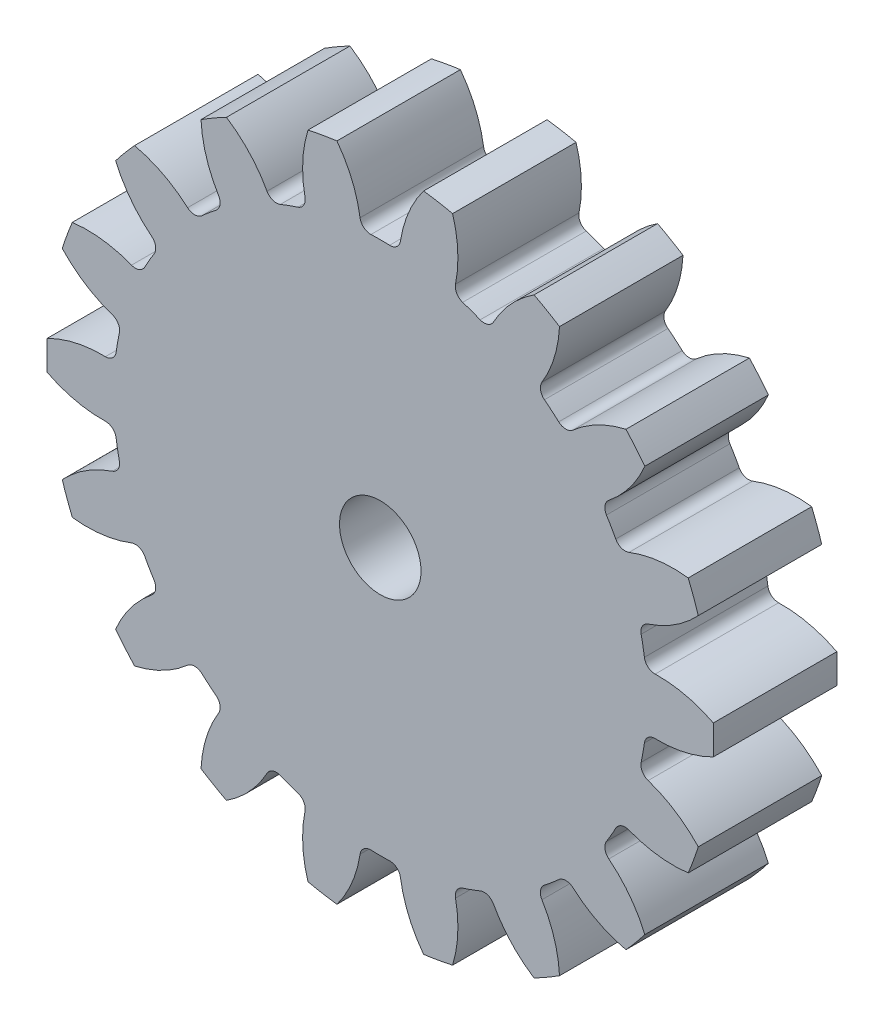
from build123d import *

# Parameters (mm, degrees)
SKETCH1_R                      = 13.5
BOSS_EXTRUDE1_DEPTH            = 2.5
CUT_EXTRUDE1_DEPTH             = 20.254869514
FILLET2_R                      = 0.43
CIRPATTERN1_COUNT              = 18
FILLET2_OF_CIRPATTERN1_R       = 0.43
THROUGH_CENTER_HOLE_DEPTH      = 20.17470347
THROUGH_CENTER_HOLE_DEPTH_BACK = 20.17470347
SKETCH4_R                      = 1.65


with BuildPart() as part:
    # Sketch1 → Boss-Extrude1 (new, symmetric)
    with BuildSketch(Plane.XY):
        Circle(SKETCH1_R)
    extrude(amount=BOSS_EXTRUDE1_DEPTH, both=True)

    # Sketch3 → Cut-Extrude1 (cut, symmetric)
    with BuildSketch(Plane.XY):
        with BuildLine():
            ThreePointArc((-1.755207316, 13.385411734), (-1.075923346, 12.149708729), (-0.774539539, 10.772190516))
            ThreePointArc((-0.774539539, 10.772190516), (0, 10.8), (0.774539539, 10.772190516))
            ThreePointArc((0.774539539, 10.772190516), (1.075923346, 12.149708729), (1.755207316, 13.385411734))
            ThreePointArc((1.755207316, 13.385411734), (0, 13.5), (-1.755207316, 13.385411734))
        make_face()
    cut_extrude1 = extrude(amount=CUT_EXTRUDE1_DEPTH, both=True, mode=Mode.SUBTRACT)

    # Fillet2
    fillet2_edges = [part.edges().sort_by_distance(p)[0] for p in [
        (-0.774539539, 10.772190516, 0),
        (0.774539539, 10.772190516, 0),
    ]]
    fillet(fillet2_edges, radius=FILLET2_R)

    # CirPattern1: Cut-Extrude1 ×18 about axis
    cirpattern1_axis = Axis((0, 0, 2.5), (0, 0, -1))
    for i in range(1, CIRPATTERN1_COUNT):
        add(cut_extrude1.rotate(cirpattern1_axis, i * 360 / CIRPATTERN1_COUNT), mode=Mode.SUBTRACT)

    # Fillet2 of CirPattern1
    fillet2_of_cirpattern1_edges = [part.edges().sort_by_distance(p)[0] for p in [
        (2.956477055, 10.387456061, 0),
        (4.412135233, 9.857639813, 0),
        (6.330898883, 8.749841104, 0),
        (7.517562302, 7.754112266, 0),
        (8.941720871, 6.056866175, 0),
        (9.71626041, 4.715324341, 0),
        (10.474039357, 2.633343796, 0),
        (10.743034116, 1.107798709, 0),
        (10.743034116, -1.107798709, 0),
        (10.474039357, -2.633343796, 0),
        (9.71626041, -4.715324341, 0),
        (8.941720871, -6.056866175, 0),
        (7.517562302, -7.754112266, 0),
        (6.330898883, -8.749841104, 0),
        (4.412135233, -9.857639813, 0),
        (2.956477055, -10.387456061, 0),
        (0.774539539, -10.772190516, 0),
        (-0.774539539, -10.772190516, 0),
        (-2.956477055, -10.387456061, 0),
        (-4.412135233, -9.857639813, 0),
        (-6.330898883, -8.749841104, 0),
        (-7.517562302, -7.754112266, 0),
        (-8.941720871, -6.056866175, 0),
        (-9.71626041, -4.715324341, 0),
        (-10.474039357, -2.633343796, 0),
        (-10.743034116, -1.107798709, 0),
        (-10.743034116, 1.107798709, 0),
        (-10.474039357, 2.633343796, 0),
        (-9.71626041, 4.715324341, 0),
        (-8.941720871, 6.056866175, 0),
        (-7.517562302, 7.754112266, 0),
        (-6.330898883, 8.749841104, 0),
        (-4.412135233, 9.857639813, 0),
        (-2.956477055, 10.387456061, 0),
    ]]
    fillet(fillet2_of_cirpattern1_edges, radius=FILLET2_OF_CIRPATTERN1_R)

    # Sketch4 → Through_Center_Hole (cut, two sides: drawn at the far end of the back side and taken through both)
    with BuildSketch(Plane.XY.offset(-THROUGH_CENTER_HOLE_DEPTH_BACK)):
        Circle(SKETCH4_R)
    extrude(amount=THROUGH_CENTER_HOLE_DEPTH + THROUGH_CENTER_HOLE_DEPTH_BACK, mode=Mode.SUBTRACT)


solid = part.part
